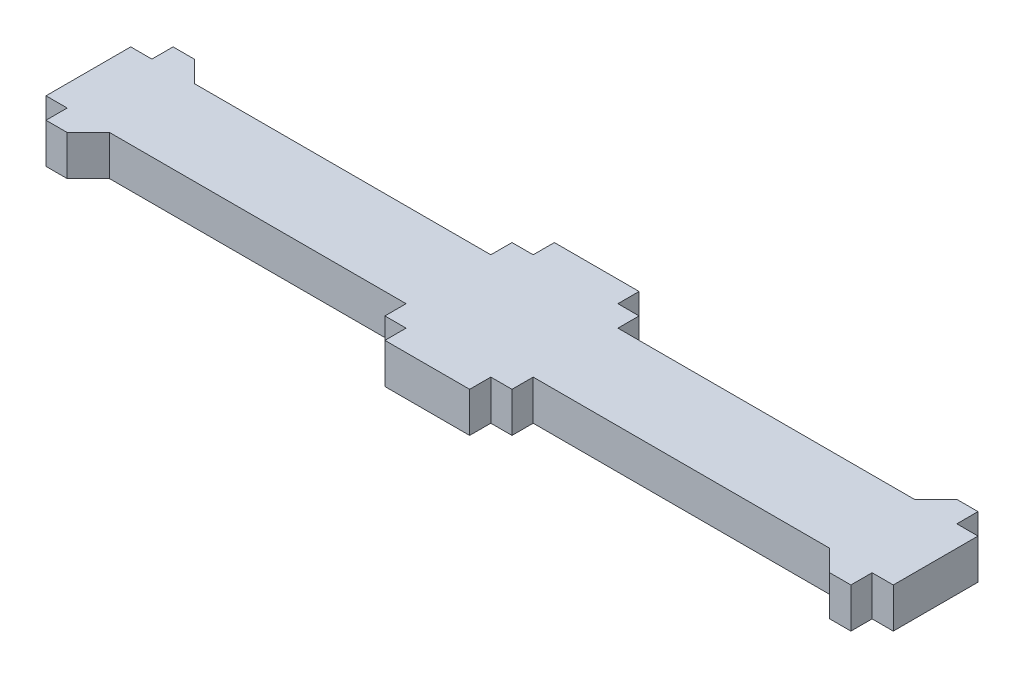
from build123d import *

# Parameters (mm, degrees)
BOSS_EXTRUDE1_DEPTH = 5.9944
CHAMFER1_SIZE       = 3.175


with BuildPart() as part:
    # Sketch1 → Boss-Extrude1 (new body)
    with BuildSketch(Plane(origin=(0, 0, 0), x_dir=(1, 0, 0), z_dir=(0, 1, 0))):
        Polygon((-53.975, 0), (-6.35, 0), (-6.35, -3.175), (-3.175, -3.175), (-3.175, 0), (0, 0), (0, 12.7), (-3.175, 12.7), (-3.175, 15.875), (-6.35, 15.875), (-6.35, 12.7), (-53.975, 12.7), (-53.975, 15.875), (-57.15, 15.875), (-57.15, 19.05), (-69.85, 19.05), (-69.85, 15.875), (-73.025, 15.875), (-73.025, 12.7), (-120.65, 12.7), (-120.65, 15.875), (-123.825, 15.875), (-123.825, 12.7), (-127, 12.7), (-127, 0), (-123.825, 0), (-123.825, -3.175), (-120.65, -3.175), (-120.65, 0), (-73.025, 0), (-73.025, -3.175), (-69.85, -3.175), (-69.85, -6.35), (-57.15, -6.35), (-57.15, -3.175), (-53.975, -3.175), align=None)
    extrude(amount=BOSS_EXTRUDE1_DEPTH)

    # Chamfer1
    chamfer1_edges = [part.edges().sort_by_distance(p)[0] for p in [
        (-6.35, 2.9972, -12.7),
        (-6.35, 2.9972, 0),
        (-120.65, 2.9972, 0),
        (-120.65, 2.9972, -12.7),
    ]]
    chamfer(chamfer1_edges, length=CHAMFER1_SIZE - 0.0001)  # a hair under: the kernel refuses the full size


solid = part.part
